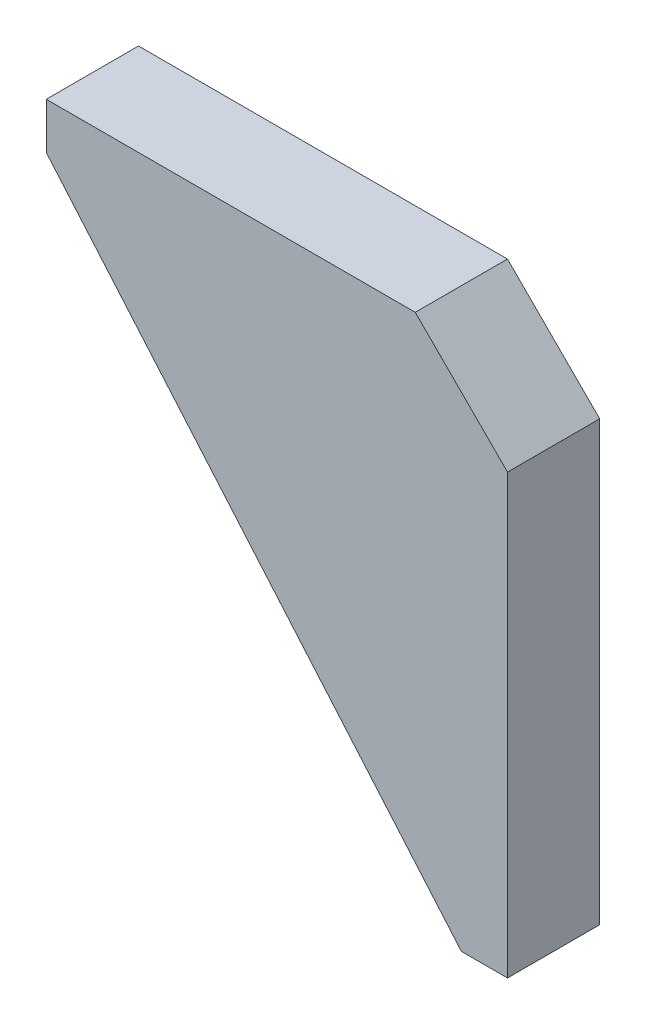
from build123d import *

# Parameters (mm, degrees)
SM_START               = -5
SM_BASE_FLANGE_1_DEPTH = 10
CHAMFER_1_SIZE         = 10


# Read off the part's stored shape, not the designer's step: Базовая кромка1
with BuildPart() as part:
    # Базовая кромка1 outline → Базовая кромка1 (new body)
    with BuildSketch(Plane.XY.offset(SM_START)):
        Polygon((0, 0), (-50, 0), (-50, -5), (-5, -57.5), (0, -57.5), align=None)
    extrude(amount=SM_BASE_FLANGE_1_DEPTH)

    # Фаска1
    chamfer_1_edges = [part.edges().sort_by_distance(p)[0] for p in [
        (0, 0, 0),
    ]]
    chamfer(chamfer_1_edges, length=CHAMFER_1_SIZE)


solid = part.part
